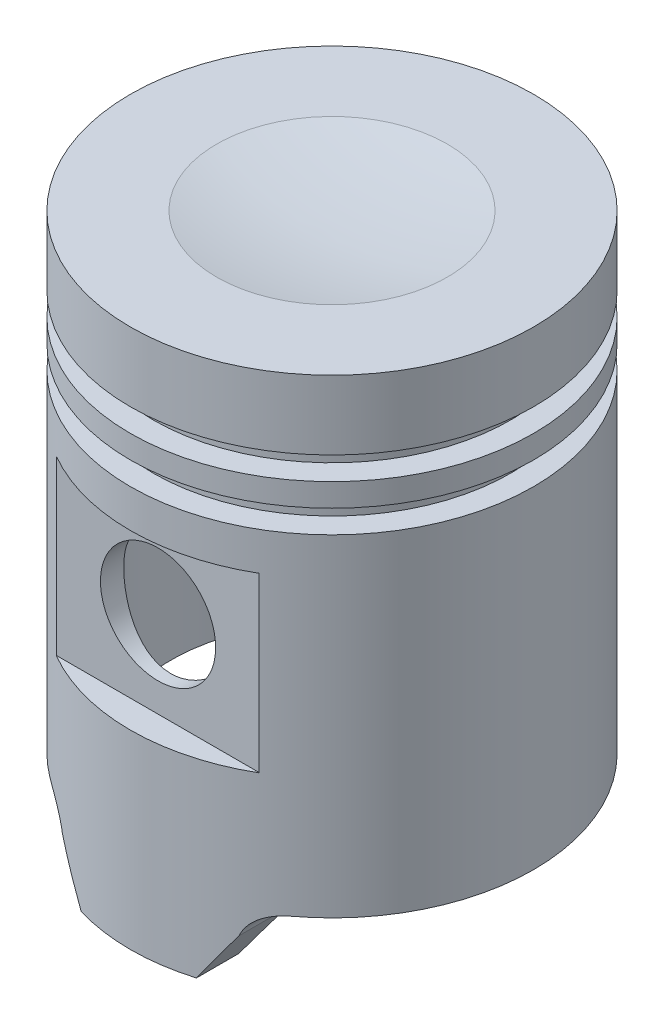
from build123d import *

# Parameters (mm, degrees)
SKETCH4_W               = 22.352
SKETCH4_H               = 19.05
CUT_EXTRUDE5_DEPTH      = 3.048
CUT_EXTRUDE6_REACH      = 76.775
CUT_EXTRUDE6_END_RADIUS = 17.78
SKETCH5_R               = 6.35
SKETCH7_W               = 22.352
SKETCH7_H               = 19.05
CUT_EXTRUDE7_DEPTH      = 3.048
CUT_EXTRUDE8_START      = -3.048
SKETCH8_R               = 6.35
CUT_EXTRUDE8_DEPTH      = 3.048
CUT_EXTRUDE9_DEPTH      = 77.505141609
CUT_EXTRUDE9_DEPTH_BACK = 77.505141609


with BuildPart() as part:
    # Sketch2 → Revolve1 (revolve)
    with BuildSketch(Plane(origin=(0, 0, 0), x_dir=(0, 0, -1), z_dir=(1, 0, 0))):
        with BuildLine():
            Line((0, -6.35), (17.78, -6.35))
            Line((17.78, -6.35), (17.78, -58.166))
            Line((17.78, -58.166), (22.225, -58.166))
            Line((22.225, -58.166), (22.225, -38.481))
            Line((22.225, -38.481), (22.225, -19.431))
            Line((22.225, -19.431), (22.225, -13.97))
            Line((22.225, -13.97), (19.685, -13.97))
            Line((19.685, -13.97), (19.685, -11.43))
            Line((19.685, -11.43), (22.225, -11.43))
            Line((22.225, -11.43), (22.225, -8.89))
            Line((22.225, -8.89), (19.685, -8.89))
            Line((19.685, -8.89), (19.685, -6.35))
            Line((19.685, -6.35), (22.225, -6.35))
            Line((22.225, -6.35), (22.225, 1.27))
            Line((22.225, 1.27), (12.712693656, 1.27))
            ThreePointArc((12.712693656, 1.27), (6.387986381, 0.318288237), (0, 0))
            Line((0, 0), (0, -6.35))
        make_face()
    revolve(axis=Axis((0, 74.511749685, 0), (0, -1, 0)))

    # Sketch4 → Cut-Extrude5 (cut)
    with BuildSketch(Plane.XY.offset(22.225)):
        with Locations((0, -27.686)):
            Rectangle(SKETCH4_W, SKETCH4_H)
    extrude(amount=-CUT_EXTRUDE5_DEPTH, mode=Mode.SUBTRACT)

    # Cut-Extrude6: up to this cylinder (the profile starts outside it)
    cut_extrude6_end = Plane(origin=(0, -27.686, 0), z_dir=(0, 1, 0)) * Cylinder(CUT_EXTRUDE6_END_RADIUS, 190.11, mode=Mode.PRIVATE)
    # Sketch5 → Cut-Extrude6 (cut, up to the surface)
    with BuildSketch(Plane.XY.offset(19.177), mode=Mode.PRIVATE) as cut_extrude6_sk1:
        with Locations((0, -27.686)):
            Circle(SKETCH5_R)
    cut_extrude6_tool1 = extrude(cut_extrude6_sk1.sketch, amount=-CUT_EXTRUDE6_REACH, mode=Mode.PRIVATE) - cut_extrude6_end
    add(cut_extrude6_tool1.solids().sort_by_distance((0, -27.686, 19.177))[0], mode=Mode.SUBTRACT)

    # Sketch7 → Cut-Extrude7 (cut)
    with BuildSketch(Plane(origin=(0, 0, -22.225), x_dir=(-1, 0, 0), z_dir=(0, 0, -1))):
        with Locations((0, -27.686)):
            Rectangle(SKETCH7_W, SKETCH7_H)
    extrude(amount=-CUT_EXTRUDE7_DEPTH, mode=Mode.SUBTRACT)

    # Sketch8 → Cut-Extrude8 (cut)
    with BuildSketch(Plane(origin=(0, 0, -19.177), x_dir=(-1, 0, 0), z_dir=(0, 0, -1)).offset(CUT_EXTRUDE8_START)):
        with Locations((0, -27.686)):
            Circle(SKETCH8_R)
    extrude(amount=CUT_EXTRUDE8_DEPTH, mode=Mode.SUBTRACT)

    # Sketch10 → Cut-Extrude9 (cut, two sides: drawn at the far end of the back side and taken through both)
    with BuildSketch(Plane.XY.offset(22.225).offset(-CUT_EXTRUDE9_DEPTH_BACK)):
        with BuildLine():
            Line((9.739132676, -53.084209933), (6.35, -58.166))
            Line((6.35, -58.166), (22.225, -58.166))
            Line((22.225, -58.166), (22.225, -50.541853728))
            Line((22.225, -50.541853728), (13.335, -50.541853728))
            ThreePointArc((13.335, -50.541853728), (11.133078289, -51.241637695), (9.739132676, -53.084209933))
        make_face()
        with BuildLine():
            Line((-22.225, -58.166), (-6.35, -58.166))
            Line((-6.35, -58.166), (-9.739132676, -53.084209933))
            ThreePointArc((-9.739132676, -53.084209933), (-11.133078289, -51.241637695), (-13.335, -50.541853728))
            Line((-13.335, -50.541853728), (-22.225, -50.541853728))
            Line((-22.225, -50.541853728), (-22.225, -58.166))
        make_face()
    extrude(amount=CUT_EXTRUDE9_DEPTH + CUT_EXTRUDE9_DEPTH_BACK, mode=Mode.SUBTRACT)


solid = part.part
